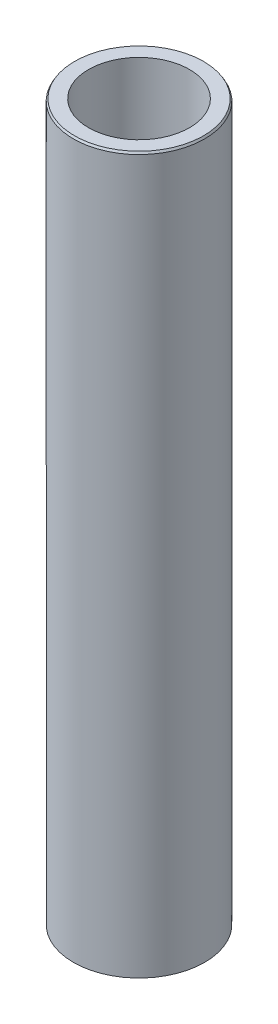
from build123d import *
from OCP.BRepFilletAPI import BRepFilletAPI_MakeChamfer

# Parameters (mm, degrees)
SKETCH1_R           = 55
BOSS_EXTRUDE1_DEPTH = 600
SKETCH2_R           = 42.28277955
CUT_EXTRUDE1_DEPTH  = 606.020660804
CHAMFER1_SIZE       = 1.727233202
CHAMFER1_SIZE2      = 0.997218554


with BuildPart() as part:
    # Sketch1 → Boss-Extrude1 (new body)
    with BuildSketch(Plane(origin=(0, 0, 0), x_dir=(1, 0, 0), z_dir=(0, 1, 0))):
        Circle(SKETCH1_R)
    extrude(amount=BOSS_EXTRUDE1_DEPTH)

    # Sketch2 → Cut-Extrude1 (cut, through all)
    with BuildSketch(Plane(origin=(0, 0, 0), x_dir=(1, 0, 0), z_dir=(0, 1, 0))):
        Circle(SKETCH2_R)
    extrude(amount=CUT_EXTRUDE1_DEPTH, mode=Mode.SUBTRACT)

    # Chamfer1: one chamfer whose edges measure the first distance from different faces: ONE call of the kernel's chamfer builder (chamfer() names one face for all edges)
    chamfer1_edges_1 = [part.edges().sort_by_distance(p)[0] for p in [
        (-55, 600, 0),
    ]]
    chamfer1_side_1 = [part.faces().sort_by_distance(p)[0] for p in [
        (-55, 300, 0),
    ]]
    chamfer1_edges_2 = [part.edges().sort_by_distance(p)[0] for p in [
        (-55, 0, 0),
    ]]
    chamfer1_side_2 = [part.faces().sort_by_distance(p)[0] for p in [
        (-53.444365081, 0, 0),
    ]]
    chamfer1 = BRepFilletAPI_MakeChamfer(part.part.solid().wrapped)
    for e in chamfer1_edges_1:
        chamfer1.Add(CHAMFER1_SIZE, CHAMFER1_SIZE2, e.wrapped, chamfer1_side_1[0].wrapped)  # the first distance lies on this face
    for e in chamfer1_edges_2:
        chamfer1.Add(CHAMFER1_SIZE, CHAMFER1_SIZE2, e.wrapped, chamfer1_side_2[0].wrapped)  # the first distance lies on this face
    add(Compound.cast(chamfer1.Shape()), mode=Mode.REPLACE)


solid = part.part
